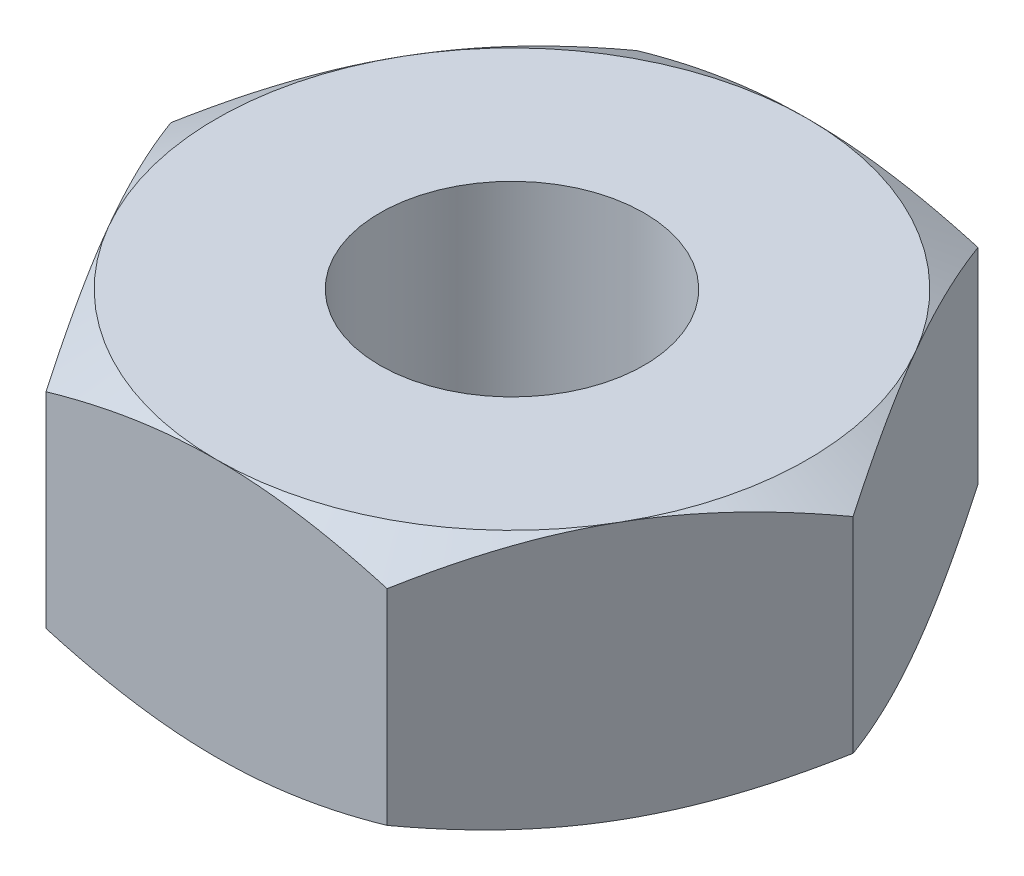
from build123d import *

# Parameters (mm, degrees)
SCHNITT_LINEAR_START            = -1e-07
SCHNITT_LINEAR_AUSTRAGEN1_DEPTH = 2.399991326


# Read off the part's stored shape, not the designer's step: Schnitt-Linear austragen1
with BuildPart() as part:
    # Skizze1 → Basis-Rotation (revolve)
    with BuildSketch(Plane.XY, mode=Mode.PRIVATE) as basis_rotation_sk:
        Polygon((1.2295, 0), (2.75, 0), (3.175426481, -0.245620093), (3.175426481, -2.154379907), (2.75, -2.4), (1.2295, -2.4), align=None)
    revolve(basis_rotation_sk.sketch.rotate(Axis((0, 0, 0), (0, -1, 0)), 90), axis=Axis((0, 0, 0), (0, -1, 0)))

    # Schnitt-Linear austragen1 outline → Schnitt-Linear austragen1 (cut)
    with BuildSketch(Plane.XZ.offset(SCHNITT_LINEAR_START)):
        with BuildLine():
            ThreePointArc((-1.58771324, -2.750000001), (0, -3.175426481), (1.58771324, -2.750000001))
            Line((1.58771324, -2.750000001), (-1.58771324, -2.750000001))
        make_face()
        with BuildLine():
            Line((3.175426481, 0), (1.58771324, -2.750000001))
            ThreePointArc((1.58771324, -2.750000001), (2.75, -1.587713241), (3.175426481, 0))
        make_face()
        with BuildLine():
            ThreePointArc((-3.175426481, 0), (-2.75, -1.587713241), (-1.58771324, -2.750000001))
            Line((-1.58771324, -2.750000001), (-3.175426481, 0))
        make_face()
        with BuildLine():
            Line((1.58771324, 2.750000001), (3.175426481, 0))
            ThreePointArc((3.175426481, 0), (2.75, 1.587713241), (1.58771324, 2.750000001))
        make_face()
        with BuildLine():
            ThreePointArc((-1.58771324, 2.750000001), (-2.75, 1.587713241), (-3.175426481, 0))
            Line((-3.175426481, 0), (-1.58771324, 2.750000001))
        make_face()
        with BuildLine():
            Line((-1.58771324, 2.750000001), (1.58771324, 2.750000001))
            ThreePointArc((1.58771324, 2.750000001), (0, 3.175426481), (-1.58771324, 2.750000001))
        make_face()
    extrude(amount=SCHNITT_LINEAR_AUSTRAGEN1_DEPTH, mode=Mode.SUBTRACT)


solid = part.part
